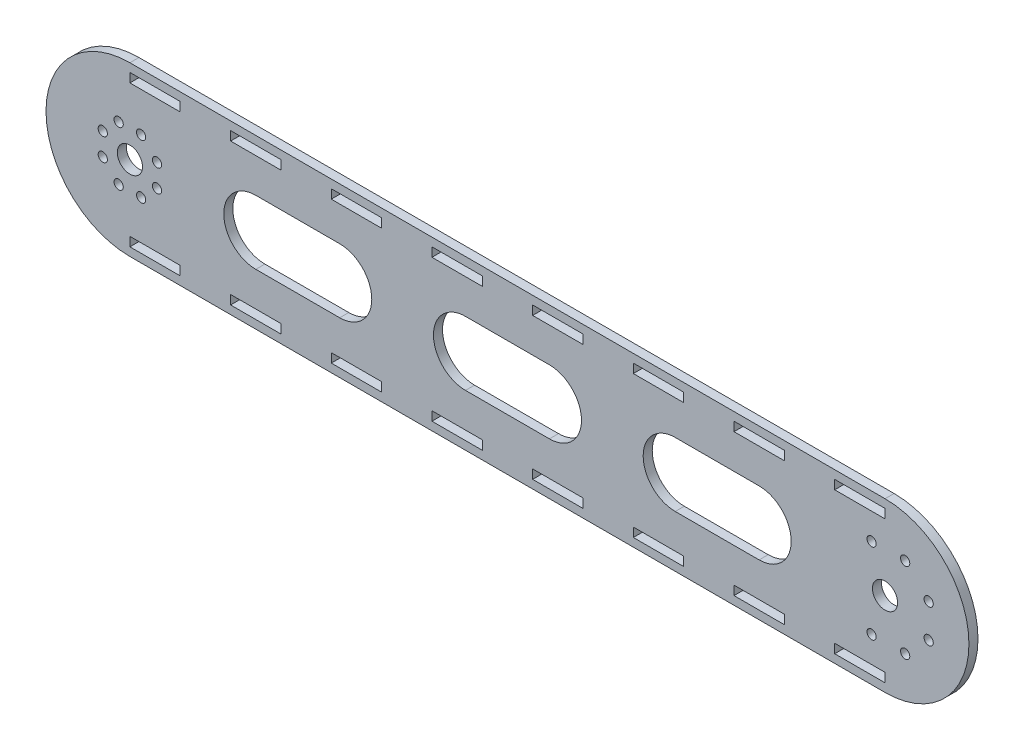
from build123d import *

# Parameters (mm, degrees)
SKETCH3_R           = 2.75
SKETCH3_R_2         = 7.5
BOSS_EXTRUDE1_DEPTH = 5.4
SKETCH4_W           = 30
SKETCH4_H           = 5.4
CUT_EXTRUDE1_DEPTH  = 482.66985355


with BuildPart() as part:
    # Sketch3 → Boss-Extrude1 (new body)
    with BuildSketch(Plane.XY):
        with BuildLine():
            Line((385.000742803, 50), (-20.962749028, 50))
            ThreePointArc((-20.962749028, 50), (-70.962749028, 0), (-20.962749028, -50))
            Line((-20.962749028, -50), (429.037250972, -50))
            ThreePointArc((429.037250972, -50), (479.037250972, 0), (429.037250972, 50))
            Line((429.037250972, 50), (385.000742803, 50))
        make_face()
        with Locations((-27.659709094, -16.167891819)):
            Circle(SKETCH3_R, mode=Mode.SUBTRACT)
        with Locations((-14.265788962, -16.167891819)):
            Circle(SKETCH3_R, mode=Mode.SUBTRACT)
        with Locations((-37.130640847, -6.696960066)):
            Circle(SKETCH3_R, mode=Mode.SUBTRACT)
        with Locations((-4.794857209, -6.696960066)):
            Circle(SKETCH3_R, mode=Mode.SUBTRACT)
        with BuildLine():
            ThreePointArc((-13.462749028, 0), (-28.318638631, -1.463177415), (-14.033652534, 2.870125743))
            ThreePointArc((-14.033652534, 2.870125743), (-13.606859425, 1.463177415), (-13.462749028, 0))
        make_face(mode=Mode.SUBTRACT)
        with BuildLine():
            ThreePointArc((54.069250972, -19.094555463), (34.974695509, 0), (54.069250972, 19.094555463))
            Line((54.069250972, 19.094555463), (104.069250972, 19.094555463))
            ThreePointArc((104.069250972, 19.094555463), (123.163806435, 0), (104.069250972, -19.094555463))
            Line((104.069250972, -19.094555463), (54.069250972, -19.094555463))
        make_face(mode=Mode.SUBTRACT)
        with BuildLine():
            ThreePointArc((179.037250972, -19.094555463), (159.942695509, 0), (179.037250972, 19.094555463))
            Line((179.037250972, 19.094555463), (229.037250972, 19.094555463))
            ThreePointArc((229.037250972, 19.094555463), (248.131806435, 0), (229.037250972, -19.094555463))
            Line((229.037250972, -19.094555463), (179.037250972, -19.094555463))
        make_face(mode=Mode.SUBTRACT)
        with BuildLine():
            ThreePointArc((304.005250972, -19.094555463), (284.910695509, 0), (304.005250972, 19.094555463))
            Line((304.005250972, 19.094555463), (354.005250972, 19.094555463))
            ThreePointArc((354.005250972, 19.094555463), (373.099806435, 0), (354.005250972, -19.094555463))
            Line((354.005250972, -19.094555463), (304.005250972, -19.094555463))
        make_face(mode=Mode.SUBTRACT)
        with Locations((421.037250972, -24)):
            Circle(SKETCH3_R, mode=Mode.SUBTRACT)
        with Locations((441.037250972, -24)):
            Circle(SKETCH3_R, mode=Mode.SUBTRACT)
        with Locations((455.037250972, -10)):
            Circle(SKETCH3_R, mode=Mode.SUBTRACT)
        with Locations((-37.130640847, 6.696960066)):
            Circle(SKETCH3_R, mode=Mode.SUBTRACT)
        with BuildLine():
            ThreePointArc((-2.044857209, 6.696960066), (-4.258358823, 3.999800545), (-7.335525923, 5.644580627))
            ThreePointArc((-7.335525923, 5.644580627), (-5.331355595, 9.394119587), (-2.044857209, 6.696960066))
        make_face(mode=Mode.SUBTRACT)
        with Locations((-27.659709094, 16.167891819)):
            Circle(SKETCH3_R, mode=Mode.SUBTRACT)
        with Locations((-14.265788962, 16.167891819)):
            Circle(SKETCH3_R, mode=Mode.SUBTRACT)
        with Locations((429.037250972, 0)):
            Circle(SKETCH3_R_2, mode=Mode.SUBTRACT)
        with Locations((455.037250972, 10)):
            Circle(SKETCH3_R, mode=Mode.SUBTRACT)
        with Locations((421.037250972, 24)):
            Circle(SKETCH3_R, mode=Mode.SUBTRACT)
        with Locations((441.037250972, 24)):
            Circle(SKETCH3_R, mode=Mode.SUBTRACT)
    extrude(amount=BOSS_EXTRUDE1_DEPTH)

    # Sketch4 → Cut-Extrude1 (cut, through all)
    with BuildSketch(Plane.XY.offset(5.4)):
        with Locations((-5.962749028, 42.3)):
            Rectangle(SKETCH4_W, SKETCH4_H)
        with Locations((54.037250972, 42.3)):
            Rectangle(SKETCH4_W, SKETCH4_H)
        with Locations((114.037250972, 42.3)):
            Rectangle(SKETCH4_W, SKETCH4_H)
        with Locations((174.037250972, 42.3)):
            Rectangle(SKETCH4_W, SKETCH4_H)
        with Locations((234.037250972, 42.3)):
            Rectangle(SKETCH4_W, SKETCH4_H)
        with Locations((294.037250972, 42.3)):
            Rectangle(SKETCH4_W, SKETCH4_H)
        with Locations((354.037250972, 42.3)):
            Rectangle(SKETCH4_W, SKETCH4_H)
        with Locations((414.037250972, 42.3)):
            Rectangle(SKETCH4_W, SKETCH4_H)
        with Locations((414.037250972, -42.3)):
            Rectangle(SKETCH4_W, SKETCH4_H)
        with Locations((354.037250972, -42.3)):
            Rectangle(SKETCH4_W, SKETCH4_H)
        with Locations((294.037250972, -42.3)):
            Rectangle(SKETCH4_W, SKETCH4_H)
        with Locations((234.037250972, -42.3)):
            Rectangle(SKETCH4_W, SKETCH4_H)
        with Locations((174.037250972, -42.3)):
            Rectangle(SKETCH4_W, SKETCH4_H)
        with Locations((114.037250972, -42.3)):
            Rectangle(SKETCH4_W, SKETCH4_H)
        with Locations((54.037250972, -42.3)):
            Rectangle(SKETCH4_W, SKETCH4_H)
        with Locations((-5.962749028, -42.3)):
            Rectangle(SKETCH4_W, SKETCH4_H)
    extrude(amount=-CUT_EXTRUDE1_DEPTH, mode=Mode.SUBTRACT)


solid = part.part
